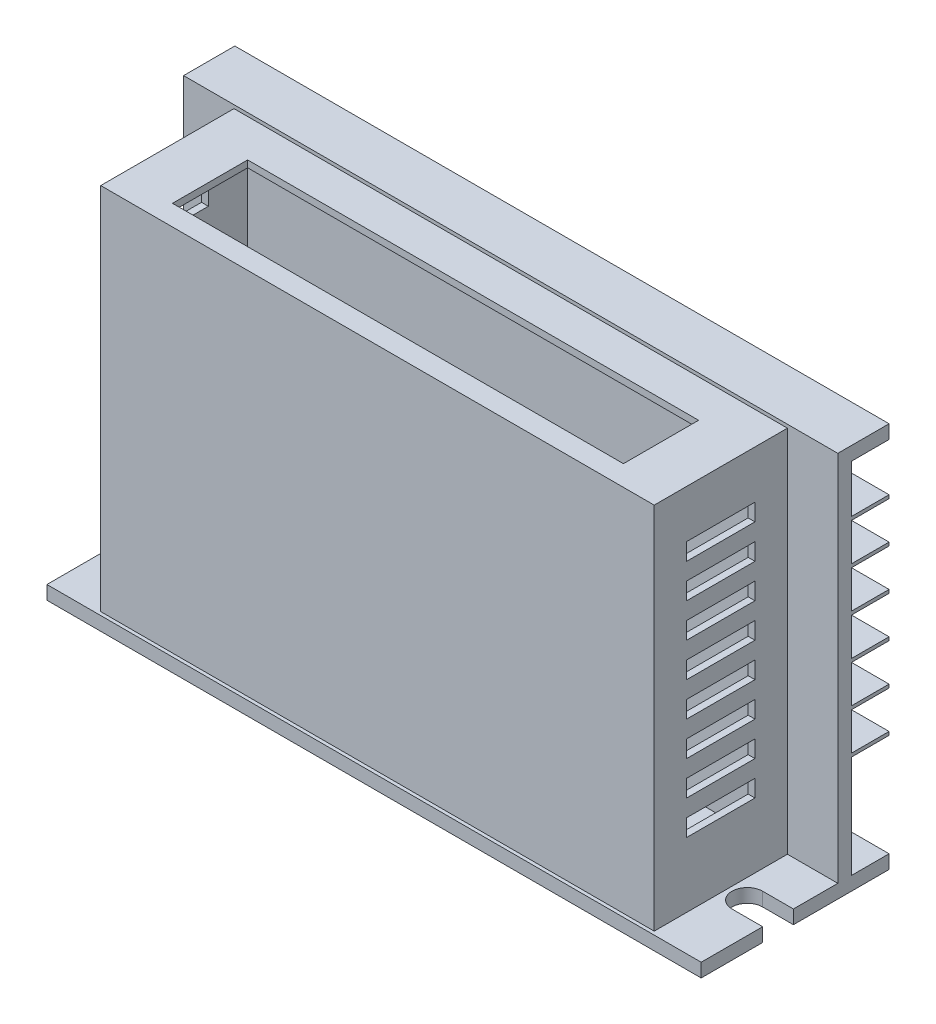
from build123d import *

# Parameters (mm, degrees)
BOSS_EXTRUDE1_DEPTH = 2
BOSS_EXTRUDE4_DEPTH = 95.75
SKETCH3_W           = 81
SKETCH3_H           = 19.5
BOSS_EXTRUDE5_DEPTH = 54
SKETCH4_W           = 10
SKETCH4_H           = 2.5
CUT_EXTRUDE1_DEPTH  = 1
SHELL1_START        = -39.5
SHELL1_OUTLINE_W    = 54
SHELL1_OUTLINE_H    = 19.5
SHELL1_DEPTH        = 79
SKETCH4_2_W         = 10
SKETCH4_2_H         = 2.5
CUT_EXTRUDE2_DEPTH  = 106.789664547
CUT_EXTRUDE3_REACH  = 107.79
SKETCH5_W           = 10
SKETCH5_H           = 18.5
SKETCH6_W           = 66
SKETCH6_H           = 11
CUT_EXTRUDE4_DEPTH  = 1


# Read off the part's stored shape, not the designer's step: Shell1
with BuildPart() as part:
    # Sketch1 → Boss-Extrude1 (new body)
    with BuildSketch(Plane(origin=(0, 0, 0), x_dir=(1, 0, 0), z_dir=(0, 1, 0))):
        with BuildLine():
            Line((-47.875, -4.75), (-47.875, -13.75))
            Line((-47.875, -13.75), (47.875, -13.75))
            Line((47.875, -13.75), (47.875, -4.75))
            Line((47.875, -4.75), (43.375, -4.75))
            ThreePointArc((43.375, -4.75), (41.125, -2.5), (43.375, -0.25))
            Line((43.375, -0.25), (47.875, -0.25))
            Line((47.875, -0.25), (47.875, 13.75))
            Line((47.875, 13.75), (-47.875, 13.75))
            Line((-47.875, 13.75), (-47.875, -0.25))
            Line((-47.875, -0.25), (-43.375, -0.25))
            ThreePointArc((-43.375, -0.25), (-41.125, -2.5), (-43.375, -4.75))
            Line((-43.375, -4.75), (-47.875, -4.75))
        make_face()
    extrude(amount=BOSS_EXTRUDE1_DEPTH)

    # Sketch2 → Boss-Extrude4 (add)
    with BuildSketch(Plane.ZY.offset(47.875)):
        Polygon((-13.75, 0), (-6.25, 0), (-6.25, 56.5), (-13.75, 56.5), (-13.75, 54.5), (-8.25, 54.5), (-8.25, 47.5), (-13.75, 47.5), (-13.75, 47), (-8.25, 47), (-8.25, 41.5), (-13.75, 41.5), (-13.75, 41), (-8.25, 41), (-8.25, 35.5), (-13.75, 35.5), (-13.75, 35), (-8.25, 35), (-8.25, 29.5), (-13.75, 29.5), (-13.75, 29), (-8.25, 29), (-8.25, 23.5), (-13.75, 23.5), (-13.75, 23), (-8.25, 23), (-8.25, 17.5), (-13.75, 17.5), (-13.75, 17), (-8.25, 17), (-8.25, 2), (-13.75, 2), align=None)
    extrude(amount=-BOSS_EXTRUDE4_DEPTH)

    # Sketch3 → Boss-Extrude5 (add)
    with BuildSketch(Plane(origin=(0, 2, 0), x_dir=(1, 0, 0), z_dir=(0, 1, 0))):
        with Locations((0, -3.5)):
            Rectangle(SKETCH3_W, SKETCH3_H)
    extrude(amount=BOSS_EXTRUDE5_DEPTH)

    # Sketch4 → Cut-Extrude1 (cut)
    with BuildSketch(Plane(origin=(40.5, 0, 0), x_dir=(0, 0, -1), z_dir=(1, 0, 0))):
        with Locations((-3.5, 47.75)):
            Rectangle(SKETCH4_W, SKETCH4_H)
        with Locations((-3.5, 42.75)):
            Rectangle(SKETCH4_W, SKETCH4_H)
        with Locations((-3.5, 37.75)):
            Rectangle(SKETCH4_W, SKETCH4_H)
        with Locations((-3.5, 32.75)):
            Rectangle(SKETCH4_W, SKETCH4_H)
        with Locations((-3.5, 27.75)):
            Rectangle(SKETCH4_W, SKETCH4_H)
        with Locations((-3.5, 22.75)):
            Rectangle(SKETCH4_W, SKETCH4_H)
        with Locations((-3.5, 17.75)):
            Rectangle(SKETCH4_W, SKETCH4_H)
        with Locations((-3.5, 12.75)):
            Rectangle(SKETCH4_W, SKETCH4_H)
    extrude(amount=-CUT_EXTRUDE1_DEPTH, mode=Mode.SUBTRACT)

    # Shell1 outline → Shell1 (cut)
    with BuildSketch(Plane.YZ.offset(SHELL1_START)):
        with Locations((28, 2.5)):
            Rectangle(SHELL1_OUTLINE_W, SHELL1_OUTLINE_H)
    extrude(amount=SHELL1_DEPTH, mode=Mode.SUBTRACT)

    # Sketch4<2> → Cut-Extrude2 (cut, through all)
    with BuildSketch(Plane(origin=(40.5, 0, 0), x_dir=(0, 0, -1), z_dir=(1, 0, 0))):
        with Locations((-3.5, 47.75)):
            Rectangle(SKETCH4_2_W, SKETCH4_2_H)
        with Locations((-3.5, 17.75)):
            Rectangle(SKETCH4_2_W, SKETCH4_2_H)
        with Locations((-3.5, 12.75)):
            Rectangle(SKETCH4_2_W, SKETCH4_2_H)
    extrude(amount=-CUT_EXTRUDE2_DEPTH, mode=Mode.SUBTRACT)

    # Sketch5 → Cut-Extrude3 (cut, up to next)
    with BuildSketch(Plane.ZY.offset(40.5), mode=Mode.PRIVATE) as cut_extrude3_sk1:
        with Locations((5, 30.25)):
            Rectangle(SKETCH5_W, SKETCH5_H)
    cut_extrude3_tool1 = extrude(cut_extrude3_sk1.sketch, amount=-CUT_EXTRUDE3_REACH, mode=Mode.PRIVATE) & part.part
    add(cut_extrude3_tool1.solids().sort_by_distance((-40.5, 30.25, 5))[0], mode=Mode.SUBTRACT)

    # Sketch6 → Cut-Extrude4 (cut)
    with BuildSketch(Plane(origin=(0, 56, 0), x_dir=(1, 0, 0), z_dir=(0, 1, 0))):
        with Locations((0, -4.75)):
            Rectangle(SKETCH6_W, SKETCH6_H)
    extrude(amount=-CUT_EXTRUDE4_DEPTH, mode=Mode.SUBTRACT)


solid = part.part
